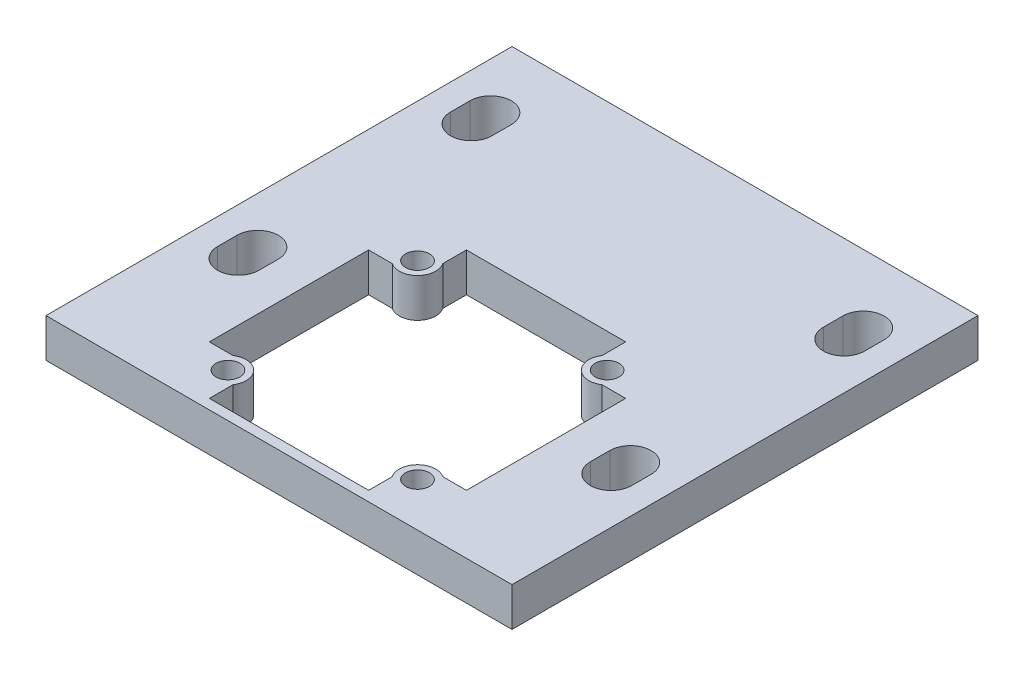
from build123d import *

# Parameters (mm, degrees)
SKETCH1_W              = 76.2
SKETCH1_H              = 76.2
BOSS_EXTRUDE1_DEPTH    = 3.175
CUT_EXTRUDE2_DEPTH     = 55.254423783
M3_5_CLEARANCE_HOLE1_D = 3.9
CUT_EXTRUDE6_DEPTH     = 55.254423783


with BuildPart() as part:
    # Sketch1 → Boss-Extrude1 (new, symmetric)
    with BuildSketch(Plane(origin=(0, 0, 0), x_dir=(1, 0, 0), z_dir=(0, 1, 0))):
        Rectangle(SKETCH1_W, SKETCH1_H)
    extrude(amount=BOSS_EXTRUDE1_DEPTH, both=True)

    # Sketch8 → Cut-Extrude2 (cut, through all)
    with BuildSketch(Plane(origin=(0, 3.175, 0), x_dir=(1, 0, 0), z_dir=(0, 1, 0))):
        with BuildLine():
            Line((-33.8582, -14.2875), (-33.8582, -11.1125))
            ThreePointArc((-33.8582, -11.1125), (-30.48, -7.7343), (-27.1018, -11.1125))
            Line((-27.1018, -11.1125), (-27.1018, -14.2875))
            ThreePointArc((-27.1018, -14.2875), (-30.48, -17.6657), (-33.8582, -14.2875))
        make_face()
        with BuildLine():
            Line((-33.8582, 23.8125), (-33.8582, 26.9875))
            ThreePointArc((-33.8582, 26.9875), (-30.48, 30.3657), (-27.1018, 26.9875))
            Line((-27.1018, 26.9875), (-27.1018, 23.8125))
            ThreePointArc((-27.1018, 23.8125), (-30.48, 20.4343), (-33.8582, 23.8125))
        make_face()
    cut_extrude2 = extrude(amount=-CUT_EXTRUDE2_DEPTH, mode=Mode.SUBTRACT)

    # Mirror1: Cut-Extrude2 across plane
    add(cut_extrude2.mirror(Plane(origin=(0, 0, 0), x_dir=(0, 0, 1), z_dir=(1, 0, 0))), mode=Mode.SUBTRACT)

    # M3.5 Clearance Hole1 (through all)
    with Locations(Plane(origin=(0, 3.175, 0), x_dir=(1, 0, 0), z_dir=(0, 1, 0))):
        with Locations((-15.5, 0.051), (15.5, 0.051), (15.5, -30.949), (-15.5, -30.949)):
            Hole(M3_5_CLEARANCE_HOLE1_D / 2)

    # Sketch23 → Cut-Extrude6 (cut, through all)
    with BuildSketch(Plane(origin=(0, 3.175, 0), x_dir=(1, 0, 0), z_dir=(0, 1, 0))):
        with BuildLine():
            Line((-13.019999998, 5.571), (-13.019999998, 1.703271161))
            ThreePointArc((-13.019999998, 1.703271161), (-13.392821798, -2.056178213), (-17.152271173, -2.428999994))
            Line((-17.152271173, -2.428999994), (-21.02, -2.428999994))
            Line((-21.02, -2.428999994), (-21.02, -28.469000006))
            Line((-21.02, -28.469000006), (-17.152271173, -28.469000006))
            ThreePointArc((-17.152271173, -28.469000006), (-13.392821798, -28.841821787), (-13.019999998, -32.601271161))
            Line((-13.019999998, -32.601271161), (-13.019999998, -36.469))
            Line((-13.019999998, -36.469), (13.019999998, -36.469))
            Line((13.019999998, -36.469), (13.019999998, -32.601271161))
            ThreePointArc((13.019999998, -32.601271161), (13.392821798, -28.841821787), (17.152271173, -28.469000006))
            Line((17.152271173, -28.469000006), (21.02, -28.469000006))
            Line((21.02, -28.469000006), (21.02, -2.428999994))
            Line((21.02, -2.428999994), (17.152271173, -2.428999994))
            ThreePointArc((17.152271173, -2.428999994), (13.392821798, -2.056178213), (13.019999998, 1.703271161))
            Line((13.019999998, 1.703271161), (13.019999998, 5.571))
            Line((13.019999998, 5.571), (-13.019999998, 5.571))
        make_face()
    extrude(amount=-CUT_EXTRUDE6_DEPTH, mode=Mode.SUBTRACT)


solid = part.part
